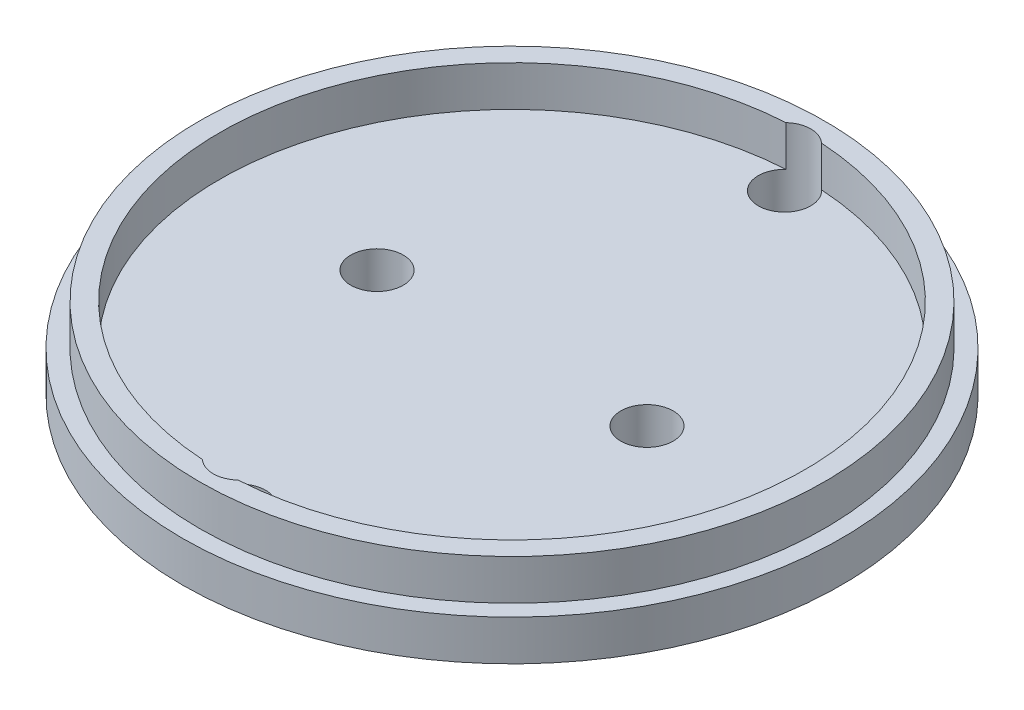
from build123d import *

# Parameters (mm, degrees)
SKETCH1_R               = 38.6
SKETCH1_R_2             = 36.1
BOSS_EXTRUDE1_DEPTH     = 5
SKETCH1_4_R             = 40.7
BOSS_EXTRUDE2_DEPTH     = 5
CUT_EXTRUDE1_DEPTH      = 59.420715504
CUT_EXTRUDE1_DEPTH_BACK = 59.420715504
SKETCH4_R               = 3.2385


with BuildPart() as part:
    # Sketch1 → Boss-Extrude1 (new body)
    with BuildSketch(Plane(origin=(0, 0, 0), x_dir=(1, 0, 0), z_dir=(0, 1, 0))):
        Circle(SKETCH1_R)
        Circle(SKETCH1_R_2, mode=Mode.SUBTRACT)
    extrude(amount=BOSS_EXTRUDE1_DEPTH)

    # Sketch1<4> → Boss-Extrude2 (add)
    with BuildSketch(Plane(origin=(0, 0, 0), x_dir=(1, 0, 0), z_dir=(0, 1, 0))):
        Circle(SKETCH1_4_R)
    extrude(amount=-BOSS_EXTRUDE2_DEPTH)

    # Sketch4 → Cut-Extrude1 (cut, two sides: drawn at the far end of the back side and taken through both)
    with BuildSketch(Plane.XZ.offset(5).offset(-CUT_EXTRUDE1_DEPTH_BACK)):
        with Locations((-16.66875, 0)):
            Circle(SKETCH4_R)
        with Locations((16.66875, 0)):
            Circle(SKETCH4_R)
        with Locations((0, 33.655)):
            Circle(SKETCH4_R)
        with Locations((0, -33.655)):
            Circle(SKETCH4_R)
    extrude(amount=CUT_EXTRUDE1_DEPTH + CUT_EXTRUDE1_DEPTH_BACK, mode=Mode.SUBTRACT)


solid = part.part
